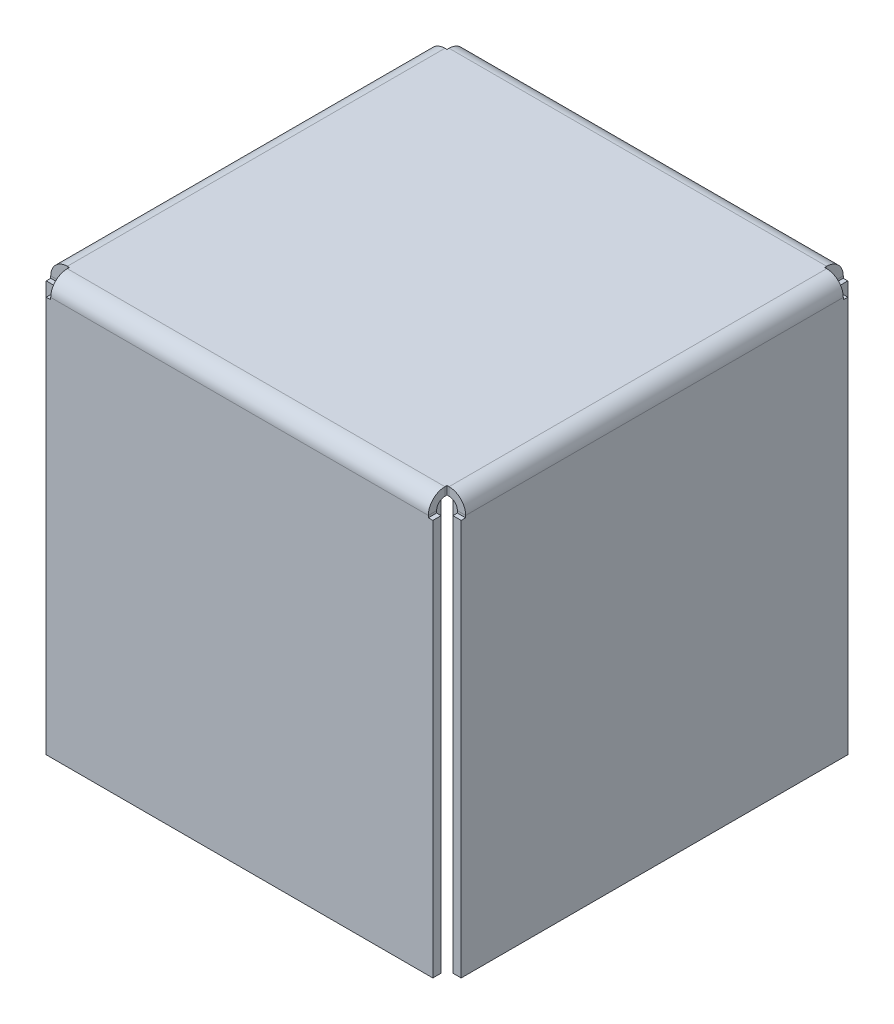
from build123d import *

# Parameters (mm, degrees)
SKETCH_1_W            = 100
SKETCH_1_H            = 100
EXTRUDE_1_DEPTH       = 100
SHELL_1_T             = -2
SHEET_START           = -51
SHEET_METAL_1_DEPTH   = 4.414213562
SHEET_START_2         = 46.585786438
SHEET_METAL_1_2_DEPTH = 4.414213562
SHEET_START_3         = -46.585786438
SHEET_METAL_1_3_DEPTH = 93.171572876
SHEET_METAL_1_4_DEPTH = 1.085786438
SHEET_START_4         = 45.5
SHEET_METAL_1_5_DEPTH = 1.085786438
SHEET_START_5         = -45.5
SHEET_METAL_1_6_DEPTH = 91
SHEET_METAL_1_7_DEPTH = 91
SHEET_METAL_1_8_DEPTH = 91


with BuildPart() as part:
    # Sketch 1 → 凸台-拉伸1 (new body)
    with BuildSketch(Plane(origin=(0, 0, 0), x_dir=(1, 0, 0), z_dir=(0, 1, 0))):
        Rectangle(SKETCH_1_W, SKETCH_1_H)
    extrude(amount=EXTRUDE_1_DEPTH)

    # 抽壳1
    shell_1_openings = [part.faces().sort_by_distance(p)[0] for p in [
        (0, 0, 0),
    ]]
    offset(amount=SHELL_1_T, openings=shell_1_openings, kind=Kind.INTERSECTION)

    # Sheet Metal 1: read off the stored shape, not the designer's step
    # Sheet Metal 1 outline → Sheet Metal 1 (cut)
    with BuildSketch(Plane.YZ.offset(SHEET_START)):
        Polygon((0, 50), (0, 46.585786438), (95.5, 46.585786438), (95.5, 45.5), (100, 45.5), (100, 50), align=None)
        Polygon((0, -46.585786438), (0, -50), (100, -50), (100, -45.5), (95.5, -45.5), (95.5, -46.585786438), align=None)
    extrude(amount=SHEET_METAL_1_DEPTH, mode=Mode.SUBTRACT)

    # Sheet Metal 1 2 outline → Sheet Metal 1 2 (cut)
    with BuildSketch(Plane.YZ.offset(SHEET_START_2)):
        Polygon((0, 50), (0, 46.585786438), (95.5, 46.585786438), (95.5, 45.5), (100, 45.5), (100, 50), align=None)
        Polygon((0, -46.585786438), (0, -50), (100, -50), (100, -45.5), (95.5, -45.5), (95.5, -46.585786438), align=None)
    extrude(amount=SHEET_METAL_1_2_DEPTH, mode=Mode.SUBTRACT)

    # Sheet Metal 1 3 outline → Sheet Metal 1 3 (cut)
    with BuildSketch(Plane.YZ.offset(SHEET_START_3)):
        with BuildLine():
            ThreePointArc((96, 50), (98.828427125, 48.828427125), (100, 46))
            Line((100, 46), (100, 50))
            Line((100, 50), (96, 50))
        make_face()
        with BuildLine():
            Line((100, -50), (100, -46))
            ThreePointArc((100, -46), (98.828427125, -48.828427125), (96, -50))
            Line((96, -50), (100, -50))
        make_face()
    extrude(amount=SHEET_METAL_1_3_DEPTH, mode=Mode.SUBTRACT)

    # Sheet Metal 1 4 outline → Sheet Metal 1 4 (cut)
    with BuildSketch(Plane.YZ.offset(SHEET_START_3)):
        with BuildLine():
            Line((98, 48), (98, 45.5))
            Line((98, 45.5), (100, 45.5))
            Line((100, 45.5), (100, 46))
            ThreePointArc((100, 46), (98.828427125, 48.828427125), (96, 50))
            Line((96, 50), (95.5, 50))
            Line((95.5, 50), (95.5, 48))
            Line((95.5, 48), (98, 48))
        make_face()
        with BuildLine():
            Line((100, -45.5), (98, -45.5))
            Line((98, -45.5), (98, -48))
            Line((98, -48), (95.5, -48))
            Line((95.5, -48), (95.5, -50))
            Line((95.5, -50), (96, -50))
            ThreePointArc((96, -50), (98.828427125, -48.828427125), (100, -46))
            Line((100, -46), (100, -45.5))
        make_face()
    extrude(amount=SHEET_METAL_1_4_DEPTH, mode=Mode.SUBTRACT)

    # Sheet Metal 1 5 outline → Sheet Metal 1 5 (cut)
    with BuildSketch(Plane.YZ.offset(SHEET_START_4)):
        with BuildLine():
            Line((98, 48), (98, 45.5))
            Line((98, 45.5), (100, 45.5))
            Line((100, 45.5), (100, 46))
            ThreePointArc((100, 46), (98.828427125, 48.828427125), (96, 50))
            Line((96, 50), (95.5, 50))
            Line((95.5, 50), (95.5, 48))
            Line((95.5, 48), (98, 48))
        make_face()
        with BuildLine():
            Line((100, -45.5), (98, -45.5))
            Line((98, -45.5), (98, -48))
            Line((98, -48), (95.5, -48))
            Line((95.5, -48), (95.5, -50))
            Line((95.5, -50), (96, -50))
            ThreePointArc((96, -50), (98.828427125, -48.828427125), (100, -46))
            Line((100, -46), (100, -45.5))
        make_face()
    extrude(amount=SHEET_METAL_1_5_DEPTH, mode=Mode.SUBTRACT)

    # Sheet Metal 1 6 outline → Sheet Metal 1 6 (add)
    with BuildSketch(Plane.YZ.offset(SHEET_START_5)):
        with BuildLine():
            ThreePointArc((96, 48), (97.414213562, 47.414213562), (98, 46))
            Line((98, 46), (98, 48))
            Line((98, 48), (96, 48))
        make_face()
        with BuildLine():
            Line((98, -48), (98, -46))
            ThreePointArc((98, -46), (97.414213562, -47.414213562), (96, -48))
            Line((96, -48), (98, -48))
        make_face()
    extrude(amount=SHEET_METAL_1_6_DEPTH)

    # Sheet Metal 1 7 outline → Sheet Metal 1 7 (cut)
    with BuildSketch(Plane.XY.offset(SHEET_START_5)):
        with BuildLine():
            Line((-50, 100), (-50, 96))
            ThreePointArc((-50, 96), (-48.828427125, 98.828427125), (-46, 100))
            Line((-46, 100), (-50, 100))
        make_face()
        with BuildLine():
            Line((50, 100), (46, 100))
            ThreePointArc((46, 100), (48.828427125, 98.828427125), (50, 96))
            Line((50, 96), (50, 100))
        make_face()
    extrude(amount=SHEET_METAL_1_7_DEPTH, mode=Mode.SUBTRACT)

    # Sheet Metal 1 8 outline → Sheet Metal 1 8 (add)
    with BuildSketch(Plane.XY.offset(SHEET_START_5)):
        with BuildLine():
            Line((-48, 98), (-48, 96))
            ThreePointArc((-48, 96), (-47.414213562, 97.414213562), (-46, 98))
            Line((-46, 98), (-48, 98))
        make_face()
        with BuildLine():
            Line((48, 98), (46, 98))
            ThreePointArc((46, 98), (47.414213562, 97.414213562), (48, 96))
            Line((48, 96), (48, 98))
        make_face()
    extrude(amount=SHEET_METAL_1_8_DEPTH)


solid = part.part
